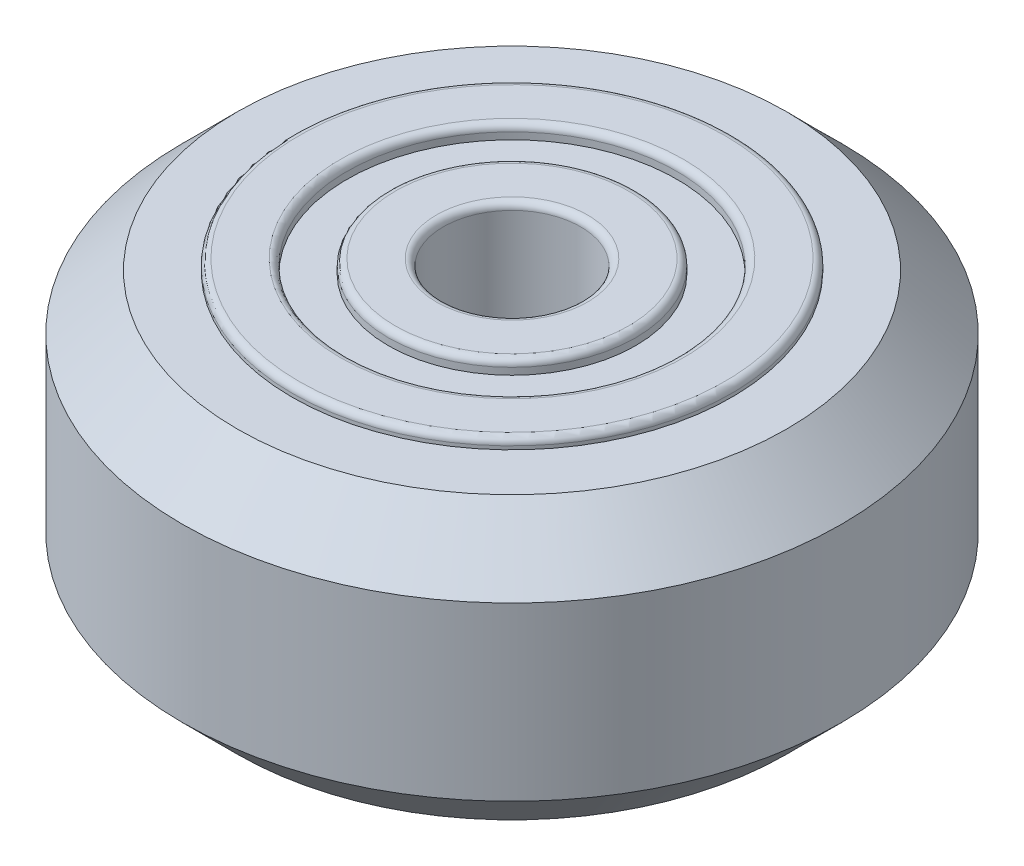
from build123d import *

# Parameters (mm, degrees)
SKETCH2_R             = 12
SKETCH2_R_2           = 8
BOSS_EXTRUDE1_DEPTH   = 5.125
SKETCH2_3_R           = 8
SKETCH2_3_R_2         = 6
BOSS_EXTRUDE2_DEPTH   = 5.5
SKETCH2_3_R_3         = 4.5
SKETCH2_3_R_4         = 2.5
BOSS_EXTRUDE2_2_DEPTH = 5.5
SKETCH2_5_R           = 6
SKETCH2_5_R_2         = 4.5
BOSS_EXTRUDE3_DEPTH   = 5
CHAMFER1_SIZE         = 2
FILLET1_R             = 0.25


with BuildPart() as part:
    # Sketch2 → Boss-Extrude1 (new, symmetric)
    with BuildSketch(Plane(origin=(0, 0, 0), x_dir=(1, 0, 0), z_dir=(0, 1, 0))):
        Circle(SKETCH2_R)
        Circle(SKETCH2_R_2, mode=Mode.SUBTRACT)
    extrude(amount=BOSS_EXTRUDE1_DEPTH, both=True)

    # Chamfer1
    chamfer1_edges = [part.edges().sort_by_distance(p)[0] for p in [
        (-12, -5.125, 0),
        (-12, 5.125, 0),
    ]]
    chamfer(chamfer1_edges, length=CHAMFER1_SIZE)


with BuildPart() as body_2:
    # Sketch2<3> → Boss-Extrude2 (new, symmetric)
    with BuildSketch(Plane(origin=(0, 0, 0), x_dir=(1, 0, 0), z_dir=(0, 1, 0))):
        Circle(SKETCH2_3_R)
        Circle(SKETCH2_3_R_2, mode=Mode.SUBTRACT)
    extrude(amount=BOSS_EXTRUDE2_DEPTH, both=True)



with BuildPart() as body_3:
    # Sketch2<3> → Boss-Extrude2 2 (new, symmetric)
    with BuildSketch(Plane(origin=(0, 0, 0), x_dir=(1, 0, 0), z_dir=(0, 1, 0))):
        Circle(SKETCH2_3_R_3)
        Circle(SKETCH2_3_R_4, mode=Mode.SUBTRACT)
    extrude(amount=BOSS_EXTRUDE2_2_DEPTH, both=True)


with BuildPart() as body_2_1:
    add(body_2.part)

    add(body_3.part)  # Boss-Extrude3 merges body 3
    # Sketch2<5> → Boss-Extrude3 (add, symmetric)
    with BuildSketch(Plane(origin=(0, 0, 0), x_dir=(1, 0, 0), z_dir=(0, 1, 0))):
        Circle(SKETCH2_5_R)
        Circle(SKETCH2_5_R_2, mode=Mode.SUBTRACT)
    extrude(amount=BOSS_EXTRUDE3_DEPTH, both=True)

    # Fillet1
    fillet1_edges = [body_2_1.edges().sort_by_distance(p)[0] for p in [
        (-4.5, -5.5, 0),
        (-2.5, -5.5, 0),
        (-4.5, 5.5, 0),
        (-2.5, 5.5, 0),
        (-8, 5.5, 0),
        (-6, 5.5, 0),
        (-8, -5.5, 0),
        (-6, -5.5, 0),
    ]]
    fillet(fillet1_edges, radius=FILLET1_R)


solid = Compound([part.part, body_2_1.part])
